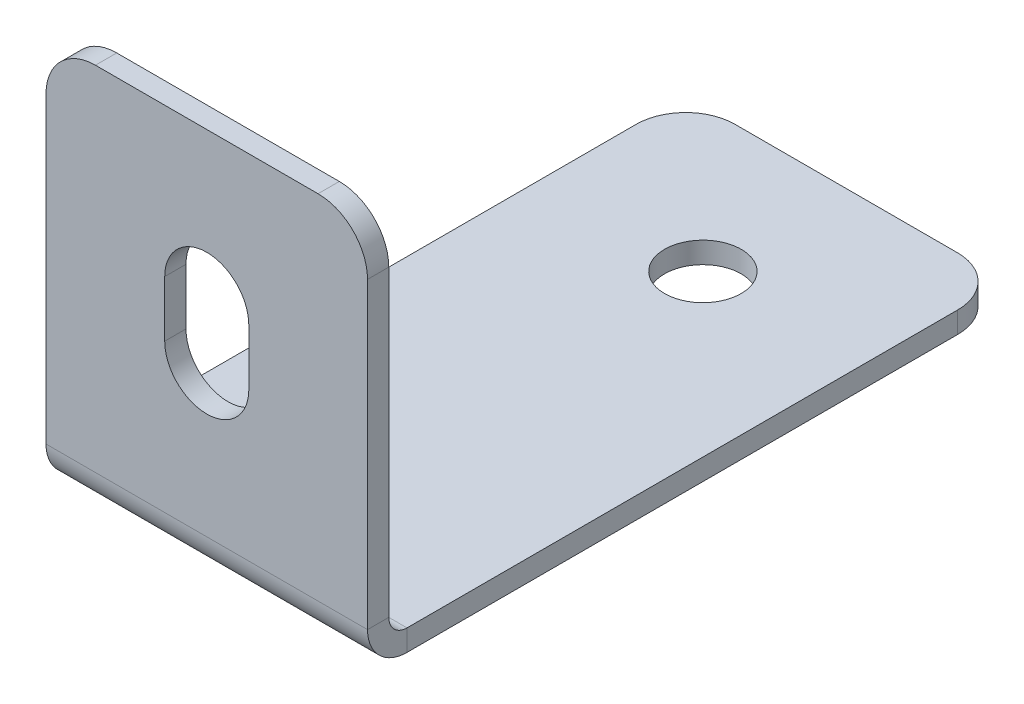
from build123d import *

# Parameters (mm, degrees)
SKETCH1_W                    = 13
SKETCH1_H                    = 25
BASE_FLANGE1_DEPTH           = 0.86
EDGE_FLANGE1_STRIP_W         = 4.9132
EDGE_FLANGE1_STRIP_H         = 0.86
EDGE_FLANGE1_STRIP_CUT_DEPTH = 13
EDGE_FLANGE1_DEPTH           = 13
FILLET1_R                    = 2
SKETCH10_R                   = 1.55
CUT_EXTRUDE1_DEPTH           = 22.112546033
CUT_EXTRUDE2_DEPTH           = 30.870554062


# Sheet-metal steps are written as plain solids
with BuildPart() as part:
    # Sketch1 → Base-Flange1 (new body)
    with BuildSketch(Plane(origin=(0, 0, 0), x_dir=(1, 0, 0), z_dir=(0, 1, 0))):
        Rectangle(SKETCH1_W, SKETCH1_H)
    extrude(amount=-BASE_FLANGE1_DEPTH)

    # Edge-Flange1 strip (across the edge) → Edge-Flange1 strip cut (cut)
    with BuildSketch(Plane(origin=(-6.5, 0, 12.5), x_dir=(0, 0, -1), z_dir=(1, 0, 0))):
        with Locations((-1.72, -0.43)):
            Rectangle(EDGE_FLANGE1_STRIP_W, EDGE_FLANGE1_STRIP_H)
    extrude(amount=EDGE_FLANGE1_STRIP_CUT_DEPTH, mode=Mode.SUBTRACT)

    # Edge-Flange1 section (across the edge) → Edge-Flange1 (add)
    with BuildSketch(Plane(origin=(-6.5, 0, 12.5), x_dir=(0, 0, -1), z_dir=(1, 0, 0))):
        with BuildLine():
            Line((-0.86, 0.7366), (-0.86, 15))
            Line((-0.86, 15), (0, 15))
            Line((0, 15), (0, 0.7366))
            ThreePointArc((0, 0.7366), (0.215745145, 0.215745145), (0.7366, 0))
            Line((0.7366, 0), (0.7366, -0.86))
            ThreePointArc((0.7366, -0.86), (-0.392366687, -0.392366687), (-0.86, 0.7366))
        make_face()
    extrude(amount=EDGE_FLANGE1_DEPTH)

    # Fillet1
    fillet1_edges = [part.edges().sort_by_distance(p)[0] for p in [
        (-6.5, 15, 12.93),
        (6.5, 15, 12.93),
        (-6.5, -0.43, -12.5),
        (6.5, -0.43, -12.5),
    ]]
    fillet(fillet1_edges, radius=FILLET1_R)

    # Sketch10 → Cut-Extrude1 (cut, through all)
    with BuildSketch(Plane(origin=(0, 0, 0), x_dir=(1, 0, 0), z_dir=(0, 1, 0))):
        with Locations(Location((0, 6.7, 0), (0, 0, 270))):
            Circle(SKETCH10_R)
    extrude(amount=-CUT_EXTRUDE1_DEPTH, mode=Mode.SUBTRACT)

    # Sketch11 → Cut-Extrude2 (cut, through all)
    with BuildSketch(Plane(origin=(0, 0, 12.5), x_dir=(-1, 0, 0), z_dir=(0, 0, -1))):
        with BuildLine():
            Line((1.7, 9), (1.7, 6.7366))
            ThreePointArc((1.7, 6.7366), (0, 5.0366), (-1.7, 6.7366))
            Line((-1.7, 6.7366), (-1.7, 9))
            ThreePointArc((-1.7, 9), (0, 10.7), (1.7, 9))
        make_face()
    extrude(amount=-CUT_EXTRUDE2_DEPTH, mode=Mode.SUBTRACT)


solid = part.part
